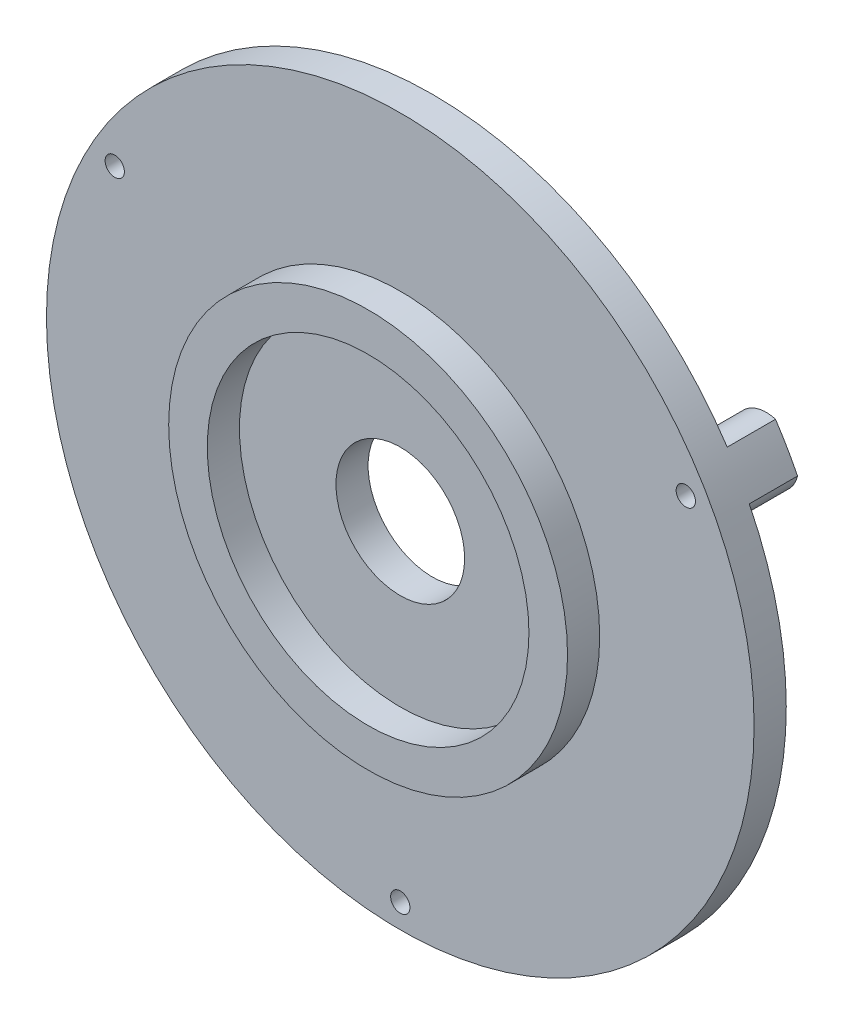
from build123d import *
from build123d.topology import SkipClean

# Parameters (mm, degrees)
SKETCH_1_R          = 22
EXTRUDE_1_DEPTH     = 2
SKETCH_2_R          = 12.4
SKETCH_2_R_2        = 10
EXTRUDE_2_DEPTH     = 2
SKETCH_3_R          = 4
CUT_EXTRUDE_1_DEPTH = 11
EXTRUDE_START       = 3
EXTRUDE_3_DEPTH     = 3
SKETCH_5_R          = 0.6
CUT_EXTRUDE_2_DEPTH = 16


with BuildPart() as part:
    # 草图1 → 凸台-拉伸1 (new body)
    with BuildSketch(Plane.XY):
        Circle(SKETCH_1_R)
    extrude(amount=EXTRUDE_1_DEPTH)

    # 草图2 → 凸台-拉伸2 (add)
    with BuildSketch(Plane.XY.offset(2)):
        Circle(SKETCH_2_R)
        Circle(SKETCH_2_R_2, mode=Mode.SUBTRACT)
    extrude(amount=EXTRUDE_2_DEPTH)

    # 草图3 → 切除-拉伸1 (cut)
    with BuildSketch(Plane.XY.offset(2)):
        Circle(SKETCH_3_R)
    extrude(amount=-CUT_EXTRUDE_1_DEPTH, mode=Mode.SUBTRACT)

    # 草图4 → 凸台-拉伸3 (add)
    with SkipClean():  # the faces are left unmerged after this step: merging them gives an invalid solid
        with BuildSketch(Plane(origin=(0, 0, 0), x_dir=(-1, 0, 0), z_dir=(0, 0, -1)).offset(EXTRUDE_START)):
            with BuildLine():
                ThreePointArc((1.369754339, -21.957317073), (0, -18.5), (-1.369754339, -21.957317073))
                ThreePointArc((-1.369754339, -21.957317073), (0, -22), (1.369754339, -21.957317073))
            make_face()
            with BuildLine():
                ThreePointArc((-19.700471554, 9.792416482), (-16.02146997, 9.25), (-18.330717215, 12.164900591))
                ThreePointArc((-18.330717215, 12.164900591), (-19.052558883, 11), (-19.700471554, 9.792416482))
            make_face()
            with BuildLine():
                ThreePointArc((18.330717215, 12.164900591), (16.02146997, 9.25), (19.700471554, 9.792416482))
                ThreePointArc((19.700471554, 9.792416482), (19.052558883, 11), (18.330717215, 12.164900591))
            make_face()
        extrude(amount=-EXTRUDE_3_DEPTH)

    # 草图5 → 切除-拉伸2 (cut)
    with SkipClean():  # the faces are left unmerged after this step: merging them gives an invalid solid
        with BuildSketch(Plane(origin=(0, 0, -3), x_dir=(-1, 0, 0), z_dir=(0, 0, -1))):
            with Locations((0, -20.5)):
                Circle(SKETCH_5_R)
            with Locations((-17.753520778, 10.25)):
                Circle(SKETCH_5_R)
            with Locations((17.753520778, 10.25)):
                Circle(SKETCH_5_R)
        extrude(amount=-CUT_EXTRUDE_2_DEPTH, mode=Mode.SUBTRACT)


solid = part.part
